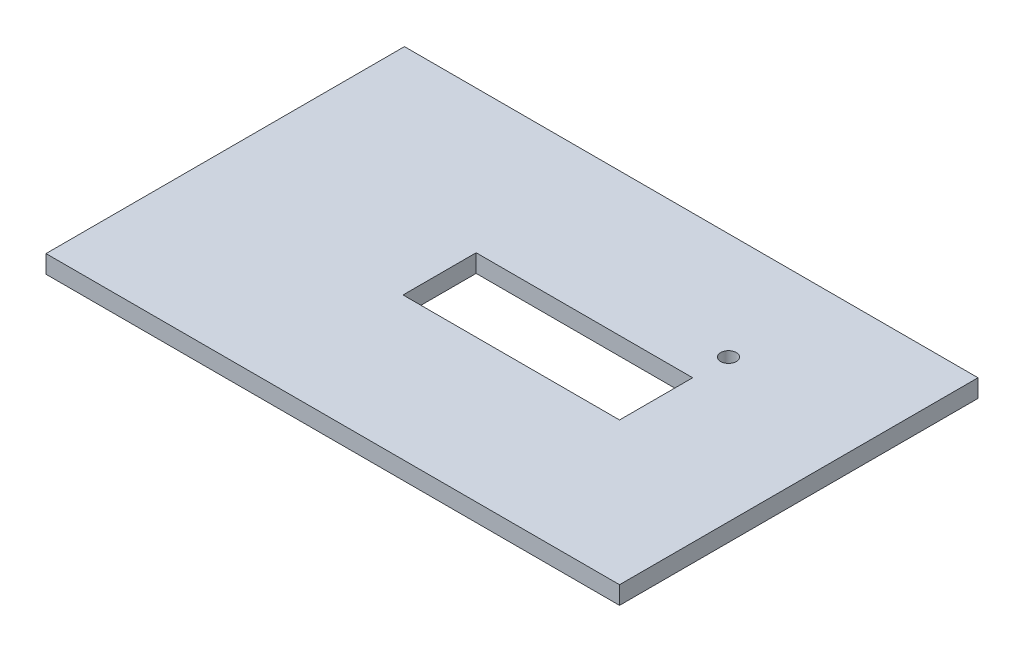
from build123d import *

# Parameters (mm, degrees)
SKETCH1_W           = 203.2
SKETCH1_H           = 127
SKETCH1_R           = 2.778125
SKETCH1_W_2         = 76.708
SKETCH1_H_2         = 25.908
BOSS_EXTRUDE1_DEPTH = 6.35


with BuildPart() as part:
    # Sketch1 → Boss-Extrude1 (new body)
    with BuildSketch(Plane(origin=(0, 0, 0), x_dir=(1, 0, 0), z_dir=(0, 1, 0))):
        with Locations((101.6, 63.5)):
            Rectangle(SKETCH1_W, SKETCH1_H)
        with Locations((152.654, 89.154)):
            Circle(SKETCH1_R, mode=Mode.SUBTRACT)
        with Locations((114.3, 63.5)):
            Rectangle(SKETCH1_W_2, SKETCH1_H_2, mode=Mode.SUBTRACT)
    extrude(amount=BOSS_EXTRUDE1_DEPTH)


solid = part.part
